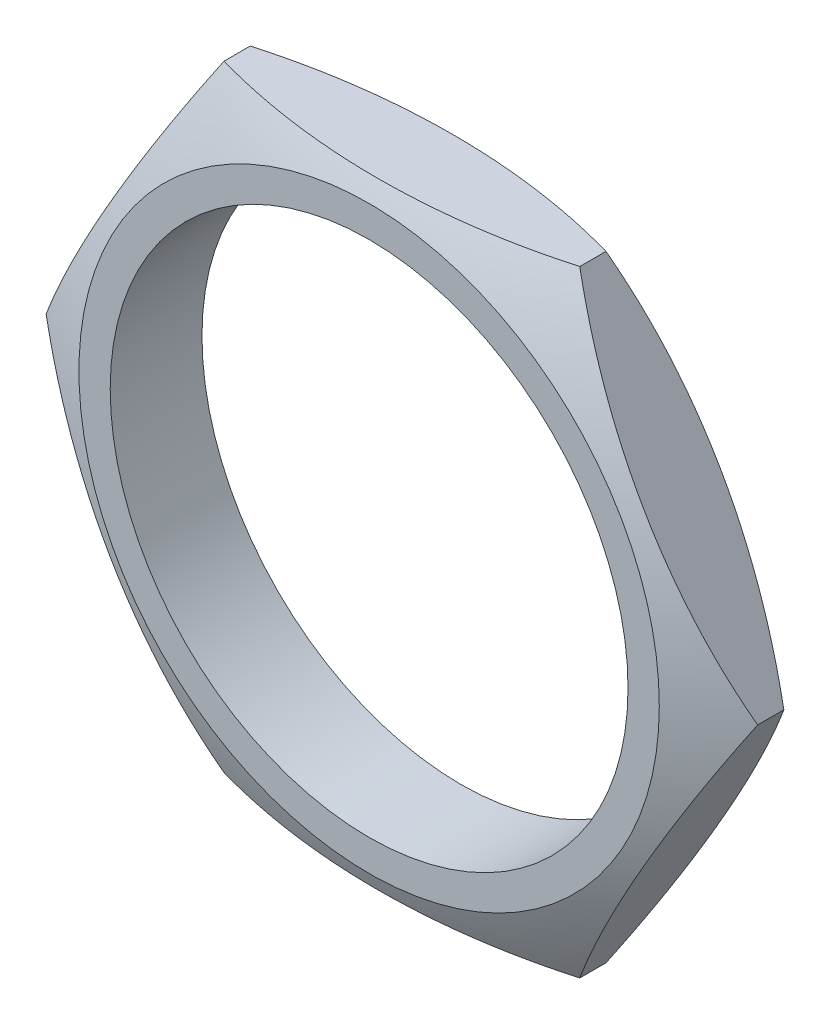
from build123d import *

# Parameters (mm, degrees)
ESQUISSE1_R        = 7.9
BOSS_EXTRU_1_DEPTH = 1.4


with BuildPart() as part:
    # Esquisse1 → Boss.-Extru.1 (new, symmetric)
    with BuildSketch(Plane.XY):
        Polygon((10.854185061, 0), (5.42709253, 9.4), (-5.42709253, 9.4), (-10.854185061, 0), (-5.42709253, -9.4), (5.42709253, -9.4), align=None)
        Circle(ESQUISSE1_R, mode=Mode.SUBTRACT)
    extrude(amount=BOSS_EXTRU_1_DEPTH, both=True)

    # Esquisse2 → Enlèvement de matière-Révolution1 (revolve, cut)
    with BuildSketch(Plane(origin=(0, 0, 0), x_dir=(1, 0, 0), z_dir=(0, 1, 0))):
        with BuildLine():
            Line((-10.854185061, 1.4), (-10.854185061, 0.4))
            ThreePointArc((-10.854185061, 0.4), (-9.866861873, 0.925353624), (-8.854185061, 1.4))
            Line((-8.854185061, 1.4), (-10.854185061, 1.4))
        make_face()
    enl_vement_de_mati_re_r_volution1 = revolve(axis=Axis((0, 0, 0), (0, 0, -1)), mode=Mode.SUBTRACT)

    # Symétrie1: Enlèvement de matière-Révolution1 across plane
    add(enl_vement_de_mati_re_r_volution1.mirror(Plane.XY), mode=Mode.SUBTRACT)


solid = part.part
